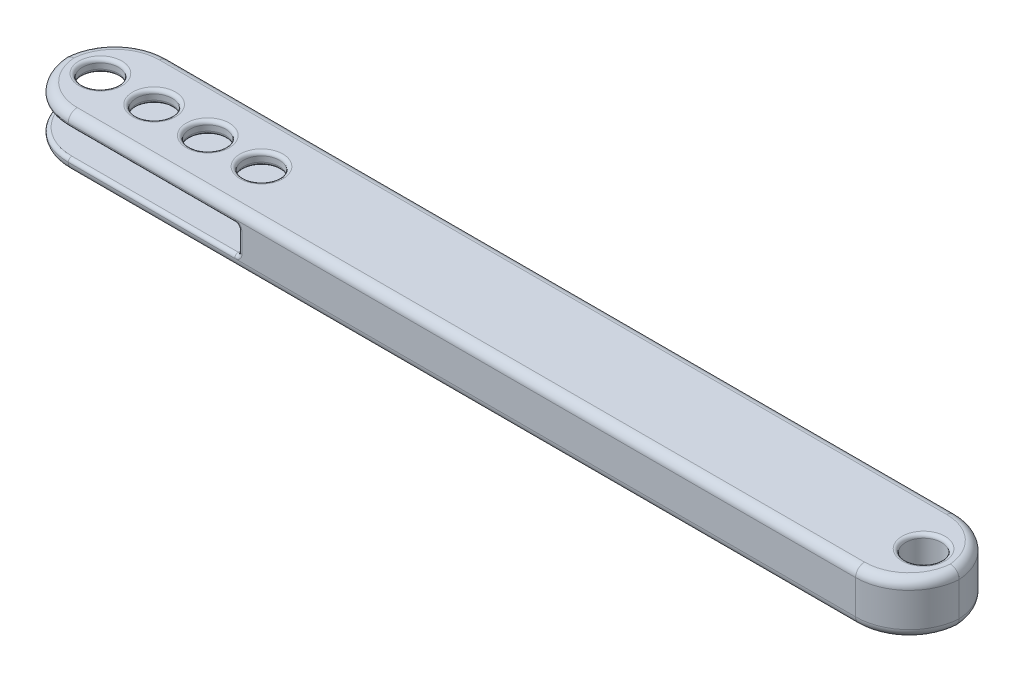
from build123d import *

# Parameters (mm, degrees)
SKETCH1_W           = 100
SKETCH1_H           = 11.2
BOSS_EXTRUDE1_DEPTH = 5.8
SKETCH2_R           = 2
CUT_EXTRUDE1_DEPTH  = 101.792261608
FILLET1_R           = 6
FILLET2_R           = 1
SKETCH3_W           = 25
SKETCH3_H           = 3
CUT_EXTRUDE2_DEPTH  = 101.779018478
FILLET3_R           = 0.4


with BuildPart() as part:
    # Sketch1 → Boss-Extrude1 (new body)
    with BuildSketch(Plane(origin=(0, 0, 0), x_dir=(1, 0, 0), z_dir=(0, 1, 0))):
        with Locations((50, 5.6)):
            Rectangle(SKETCH1_W, SKETCH1_H)
    extrude(amount=BOSS_EXTRUDE1_DEPTH)

    # Sketch2 → Cut-Extrude1 (cut, through all)
    with BuildSketch(Plane(origin=(0, 5.8, 0), x_dir=(1, 0, 0), z_dir=(0, 1, 0))):
        with Locations(Location((4, 5.6, 0), (0, 0, 270))):
            Circle(SKETCH2_R)
        with Locations(Location((96, 5.6, 0), (0, 0, 270))):
            Circle(SKETCH2_R)
        with Locations(Location((10, 5.6, 0), (0, 0, 270))):
            Circle(SKETCH2_R)
        with Locations(Location((16, 5.6, 0), (0, 0, 270))):
            Circle(SKETCH2_R)
        with Locations(Location((22, 5.6, 0), (0, 0, 270))):
            Circle(SKETCH2_R)
    extrude(amount=-CUT_EXTRUDE1_DEPTH, mode=Mode.SUBTRACT)

    # Fillet1
    # the kernel refuses this fillet: 6 mm, written as the material it takes off along each edge
    with BuildSketch(Plane(origin=(100, -15, 0), x_dir=(-1, 0, 0), z_dir=(0, 1, 0)), Plane(origin=(100, -15, -11.2), x_dir=(0, 0, 1), z_dir=(0, 1, 0))) as fillet1_piece_1:
        with BuildLine():
            CenterArc((FILLET1_R, -FILLET1_R), FILLET1_R, 90, 90)
            Line((0, -FILLET1_R), (0, 0))
            Line((0, 0), (FILLET1_R, 0))
        make_face()
    extrude(amount=35.8, mode=Mode.SUBTRACT)
    with BuildSketch(Plane(origin=(0, -15, -11.2), x_dir=(0, 0, 1), z_dir=(0, 1, 0)), Plane(origin=(0, -15, 0), x_dir=(1, 0, 0), z_dir=(0, 1, 0))) as fillet1_piece_2:
        with BuildLine():
            CenterArc((FILLET1_R, FILLET1_R), FILLET1_R, 180, 90)
            Line((0, FILLET1_R), (0, 0))
            Line((0, 0), (FILLET1_R, 0))
        make_face()
    extrude(amount=35.8, mode=Mode.SUBTRACT)

    # Fillet2
    # the kernel refuses this fillet: 1 mm, written as the material it takes off along each edge
    with BuildSketch(Plane(origin=(94, 0, -11.2), x_dir=(0, 0, 1), z_dir=(-1, 0, 0)), Plane(origin=(6, 5.8, 0), x_dir=(0, -1, 0), z_dir=(1, 0, 0))) as fillet2_piece_1:
        with BuildLine():
            CenterArc((FILLET2_R, FILLET2_R), FILLET2_R, 180, 90)
            Line((0, FILLET2_R), (0, 0))
            Line((0, 0), (FILLET2_R, 0))
        make_face()
    extrude(amount=88, mode=Mode.SUBTRACT)
    with BuildSketch(Plane(origin=(6, 0, 0), x_dir=(0, 1, 0), z_dir=(1, 0, 0)), Plane(origin=(94, 5.8, -11.2), x_dir=(0, 0, 1), z_dir=(-1, 0, 0))) as fillet2_piece_2:
        with BuildLine():
            CenterArc((FILLET2_R, -FILLET2_R), FILLET2_R, 90, 90)
            Line((0, -FILLET2_R), (0, 0))
            Line((0, 0), (FILLET2_R, 0))
        make_face()
    extrude(amount=88, mode=Mode.SUBTRACT)
    with BuildSketch(Plane(origin=(94, 0, -5.2), x_dir=(0, 0, -1), z_dir=(-1, 0, 0))) as fillet2_piece_3:
        with BuildLine():
            CenterArc((6 - FILLET2_R, -FILLET2_R), FILLET2_R, 0, 90)
            Line((6, -FILLET2_R), (6, 0))
            Line((6, 0), (6 - FILLET2_R, 0))
        make_face()
    revolve(axis=Axis((94, 0, -5.2), (0, -1, 0)), revolution_arc=110.05948027, mode=Mode.SUBTRACT)
    with BuildSketch(Plane(origin=(94, 0, -6), x_dir=(0.9393370543039388, 0, -0.3429954787043108), z_dir=(-0.3429954787043108, 0, -0.9393370543039388))) as fillet2_piece_4:
        with BuildLine():
            CenterArc((6 - FILLET2_R, -FILLET2_R), FILLET2_R, 0, 90)
            Line((6, -FILLET2_R), (6, 0))
            Line((6, 0), (6 - FILLET2_R, 0))
        make_face()
    revolve(axis=Axis((94, 0, -6), (0, -1, 0)), revolution_arc=110.05948027, mode=Mode.SUBTRACT)
    with BuildSketch(Plane(origin=(6, 0, -6), x_dir=(0, 0, 1), z_dir=(1, 0, 0))) as fillet2_piece_5:
        with BuildLine():
            CenterArc((6 - FILLET2_R, -FILLET2_R), FILLET2_R, 0, 90)
            Line((6, -FILLET2_R), (6, 0))
            Line((6, 0), (6 - FILLET2_R, 0))
        make_face()
    revolve(axis=Axis((6, 0, -6), (0, -1, 0)), revolution_arc=110.05948027, mode=Mode.SUBTRACT)
    with BuildSketch(Plane(origin=(6, 0, -5.2), x_dir=(-0.9393370543039198, 0, 0.3429954787043625), z_dir=(0.3429954787043625, 0, 0.9393370543039198))) as fillet2_piece_6:
        with BuildLine():
            CenterArc((6 - FILLET2_R, -FILLET2_R), FILLET2_R, 0, 90)
            Line((6, -FILLET2_R), (6, 0))
            Line((6, 0), (6 - FILLET2_R, 0))
        make_face()
    revolve(axis=Axis((6, 0, -5.2), (0, -1, 0)), revolution_arc=110.05948027, mode=Mode.SUBTRACT)
    with BuildSketch(Plane(origin=(94, 5.8, -5.2), x_dir=(0, 0, -1), z_dir=(-1, 0, 0))) as fillet2_piece_7:
        with BuildLine():
            CenterArc((6 - FILLET2_R, FILLET2_R), FILLET2_R, 270, 90)
            Line((6, FILLET2_R), (6, 0))
            Line((6, 0), (6 - FILLET2_R, 0))
        make_face()
    revolve(axis=Axis((94, 5.8, -5.2), (0, -1, 0)), revolution_arc=110.05948027, mode=Mode.SUBTRACT)
    with BuildSketch(Plane(origin=(94, 5.8, -6), x_dir=(0.9393370543039388, 0, -0.3429954787043108), z_dir=(-0.3429954787043108, 0, -0.9393370543039388))) as fillet2_piece_8:
        with BuildLine():
            CenterArc((6 - FILLET2_R, FILLET2_R), FILLET2_R, 270, 90)
            Line((6 - FILLET2_R, 0), (6, 0))
            Line((6, 0), (6, FILLET2_R))
        make_face()
    revolve(axis=Axis((94, 5.8, -6), (0, -1, 0)), revolution_arc=110.05948027, mode=Mode.SUBTRACT)
    with BuildSketch(Plane(origin=(6, 5.8, -6), x_dir=(0, 0, 1), z_dir=(1, 0, 0))) as fillet2_piece_9:
        with BuildLine():
            CenterArc((6 - FILLET2_R, FILLET2_R), FILLET2_R, 270, 90)
            Line((6, FILLET2_R), (6, 0))
            Line((6, 0), (6 - FILLET2_R, 0))
        make_face()
    revolve(axis=Axis((6, 5.8, -6), (0, -1, 0)), revolution_arc=110.05948027, mode=Mode.SUBTRACT)
    with BuildSketch(Plane(origin=(6, 5.8, -5.2), x_dir=(-0.9393370543039198, 0, 0.3429954787043625), z_dir=(0.3429954787043625, 0, 0.9393370543039198))) as fillet2_piece_10:
        with BuildLine():
            CenterArc((6 - FILLET2_R, FILLET2_R), FILLET2_R, 270, 90)
            Line((6, FILLET2_R), (6, 0))
            Line((6, 0), (6 - FILLET2_R, 0))
        make_face()
    revolve(axis=Axis((6, 5.8, -5.2), (0, -1, 0)), revolution_arc=110.05948027, mode=Mode.SUBTRACT)

    # Sketch3 → Cut-Extrude2 (cut, through all)
    with BuildSketch(Plane(origin=(0, 0, -11.2), x_dir=(-1, 0, 0), z_dir=(0, 0, -1))):
        with Locations((-12.513348181, 2.9)):
            Rectangle(SKETCH3_W, SKETCH3_H)
    extrude(amount=-CUT_EXTRUDE2_DEPTH, mode=Mode.SUBTRACT)

    # Fillet3
    # the kernel refuses this fillet: 0.4 mm, written as the material it adds along each edge
    with BuildSketch(Plane(origin=(25.013348181, 4.4, -11.2), x_dir=(-1, 0, 0), z_dir=(0, 0, 1)), Plane(origin=(25.013348181, 1.4, -11.2), x_dir=(0, 1, 0), z_dir=(0, 0, 1))) as fillet3_piece_1:
        with BuildLine():
            CenterArc((FILLET3_R, FILLET3_R), FILLET3_R, 180, 90)
            Line((0, FILLET3_R), (0, 0))
            Line((0, 0), (FILLET3_R, 0))
        make_face()
    extrude(amount=11.2)
    # the kernel refuses this fillet: 0.4 mm, written as the material it takes off along each edge
    with BuildSketch(Plane(origin=(96, 5.8, -5.6), x_dir=(0, 0, 1), z_dir=(-1, 0, 0))) as fillet3_2_piece_1:
        with BuildLine():
            CenterArc((2 + FILLET3_R, -FILLET3_R), FILLET3_R, 90, 90)
            Line((2, -FILLET3_R), (2, 0))
            Line((2, 0), (2 + FILLET3_R, 0))
        make_face()
    revolve(axis=Axis((96, 5.8, -5.6), (0, 1, 0)), mode=Mode.SUBTRACT)
    with BuildSketch(Plane(origin=(96, 0, -5.6), x_dir=(0, 0, 1), z_dir=(-1, 0, 0))) as fillet3_2_piece_2:
        with BuildLine():
            CenterArc((2 + FILLET3_R, FILLET3_R), FILLET3_R, 180, 90)
            Line((2, FILLET3_R), (2, 0))
            Line((2, 0), (2 + FILLET3_R, 0))
        make_face()
    revolve(axis=Axis((96, 0, -5.6), (0, 1, 0)), mode=Mode.SUBTRACT)
    with BuildSketch(Plane(origin=(4, 5.8, -5.6), x_dir=(0, 0, 1), z_dir=(-1, 0, 0))) as fillet3_2_piece_3:
        with BuildLine():
            CenterArc((2 + FILLET3_R, -FILLET3_R), FILLET3_R, 90, 90)
            Line((2, -FILLET3_R), (2, 0))
            Line((2, 0), (2 + FILLET3_R, 0))
        make_face()
    revolve(axis=Axis((4, 5.8, -5.6), (0, 1, 0)), mode=Mode.SUBTRACT)
    with BuildSketch(Plane(origin=(4, 4.4, -5.6), x_dir=(0, 0, 1), z_dir=(-1, 0, 0))) as fillet3_2_piece_4:
        with BuildLine():
            CenterArc((2 + FILLET3_R, FILLET3_R), FILLET3_R, 180, 90)
            Line((2, FILLET3_R), (2, 0))
            Line((2, 0), (2 + FILLET3_R, 0))
        make_face()
    revolve(axis=Axis((4, 4.4, -5.6), (0, 1, 0)), mode=Mode.SUBTRACT)
    with BuildSketch(Plane(origin=(4, 0, -5.6), x_dir=(0, 0, 1), z_dir=(-1, 0, 0))) as fillet3_2_piece_5:
        with BuildLine():
            CenterArc((2 + FILLET3_R, FILLET3_R), FILLET3_R, 180, 90)
            Line((2, FILLET3_R), (2, 0))
            Line((2, 0), (2 + FILLET3_R, 0))
        make_face()
    revolve(axis=Axis((4, 0, -5.6), (0, 1, 0)), mode=Mode.SUBTRACT)
    with BuildSketch(Plane(origin=(4, 1.4, -5.6), x_dir=(0, 0, 1), z_dir=(-1, 0, 0))) as fillet3_2_piece_6:
        with BuildLine():
            CenterArc((2 + FILLET3_R, -FILLET3_R), FILLET3_R, 90, 90)
            Line((2, -FILLET3_R), (2, 0))
            Line((2, 0), (2 + FILLET3_R, 0))
        make_face()
    revolve(axis=Axis((4, 1.4, -5.6), (0, 1, 0)), mode=Mode.SUBTRACT)
    with BuildSketch(Plane(origin=(22, 0, -5.6), x_dir=(0, 0, 1), z_dir=(-1, 0, 0))) as fillet3_2_piece_7:
        with BuildLine():
            CenterArc((2 + FILLET3_R, FILLET3_R), FILLET3_R, 180, 90)
            Line((2, FILLET3_R), (2, 0))
            Line((2, 0), (2 + FILLET3_R, 0))
        make_face()
    revolve(axis=Axis((22, 0, -5.6), (0, 1, 0)), mode=Mode.SUBTRACT)
    with BuildSketch(Plane(origin=(22, 1.4, -5.6), x_dir=(0, 0, 1), z_dir=(-1, 0, 0))) as fillet3_2_piece_8:
        with BuildLine():
            CenterArc((2 + FILLET3_R, -FILLET3_R), FILLET3_R, 90, 90)
            Line((2, -FILLET3_R), (2, 0))
            Line((2, 0), (2 + FILLET3_R, 0))
        make_face()
    revolve(axis=Axis((22, 1.4, -5.6), (0, 1, 0)), mode=Mode.SUBTRACT)
    with BuildSketch(Plane(origin=(22, 5.8, -5.6), x_dir=(0, 0, 1), z_dir=(-1, 0, 0))) as fillet3_2_piece_9:
        with BuildLine():
            CenterArc((2 + FILLET3_R, -FILLET3_R), FILLET3_R, 90, 90)
            Line((2, -FILLET3_R), (2, 0))
            Line((2, 0), (2 + FILLET3_R, 0))
        make_face()
    revolve(axis=Axis((22, 5.8, -5.6), (0, 1, 0)), mode=Mode.SUBTRACT)
    with BuildSketch(Plane(origin=(22, 4.4, -5.6), x_dir=(0, 0, 1), z_dir=(-1, 0, 0))) as fillet3_2_piece_10:
        with BuildLine():
            CenterArc((2 + FILLET3_R, FILLET3_R), FILLET3_R, 180, 90)
            Line((2, FILLET3_R), (2, 0))
            Line((2, 0), (2 + FILLET3_R, 0))
        make_face()
    revolve(axis=Axis((22, 4.4, -5.6), (0, 1, 0)), mode=Mode.SUBTRACT)
    with BuildSketch(Plane(origin=(16, 0, -5.6), x_dir=(0, 0, 1), z_dir=(-1, 0, 0))) as fillet3_2_piece_11:
        with BuildLine():
            CenterArc((2 + FILLET3_R, FILLET3_R), FILLET3_R, 180, 90)
            Line((2, FILLET3_R), (2, 0))
            Line((2, 0), (2 + FILLET3_R, 0))
        make_face()
    revolve(axis=Axis((16, 0, -5.6), (0, 1, 0)), mode=Mode.SUBTRACT)
    with BuildSketch(Plane(origin=(16, 1.4, -5.6), x_dir=(0, 0, 1), z_dir=(-1, 0, 0))) as fillet3_2_piece_12:
        with BuildLine():
            CenterArc((2 + FILLET3_R, -FILLET3_R), FILLET3_R, 90, 90)
            Line((2, -FILLET3_R), (2, 0))
            Line((2, 0), (2 + FILLET3_R, 0))
        make_face()
    revolve(axis=Axis((16, 1.4, -5.6), (0, 1, 0)), mode=Mode.SUBTRACT)
    with BuildSketch(Plane(origin=(16, 5.8, -5.6), x_dir=(0, 0, 1), z_dir=(-1, 0, 0))) as fillet3_2_piece_13:
        with BuildLine():
            CenterArc((2 + FILLET3_R, -FILLET3_R), FILLET3_R, 90, 90)
            Line((2, -FILLET3_R), (2, 0))
            Line((2, 0), (2 + FILLET3_R, 0))
        make_face()
    revolve(axis=Axis((16, 5.8, -5.6), (0, 1, 0)), mode=Mode.SUBTRACT)
    with BuildSketch(Plane(origin=(16, 4.4, -5.6), x_dir=(0, 0, 1), z_dir=(-1, 0, 0))) as fillet3_2_piece_14:
        with BuildLine():
            CenterArc((2 + FILLET3_R, FILLET3_R), FILLET3_R, 180, 90)
            Line((2, FILLET3_R), (2, 0))
            Line((2, 0), (2 + FILLET3_R, 0))
        make_face()
    revolve(axis=Axis((16, 4.4, -5.6), (0, 1, 0)), mode=Mode.SUBTRACT)
    with BuildSketch(Plane(origin=(10, 0, -5.6), x_dir=(0, 0, 1), z_dir=(-1, 0, 0))) as fillet3_2_piece_15:
        with BuildLine():
            CenterArc((2 + FILLET3_R, FILLET3_R), FILLET3_R, 180, 90)
            Line((2, FILLET3_R), (2, 0))
            Line((2, 0), (2 + FILLET3_R, 0))
        make_face()
    revolve(axis=Axis((10, 0, -5.6), (0, 1, 0)), mode=Mode.SUBTRACT)
    with BuildSketch(Plane(origin=(10, 1.4, -5.6), x_dir=(0, 0, 1), z_dir=(-1, 0, 0))) as fillet3_2_piece_16:
        with BuildLine():
            CenterArc((2 + FILLET3_R, -FILLET3_R), FILLET3_R, 90, 90)
            Line((2, -FILLET3_R), (2, 0))
            Line((2, 0), (2 + FILLET3_R, 0))
        make_face()
    revolve(axis=Axis((10, 1.4, -5.6), (0, 1, 0)), mode=Mode.SUBTRACT)
    with BuildSketch(Plane(origin=(10, 5.8, -5.6), x_dir=(0, 0, 1), z_dir=(-1, 0, 0))) as fillet3_2_piece_17:
        with BuildLine():
            CenterArc((2 + FILLET3_R, -FILLET3_R), FILLET3_R, 90, 90)
            Line((2, -FILLET3_R), (2, 0))
            Line((2, 0), (2 + FILLET3_R, 0))
        make_face()
    revolve(axis=Axis((10, 5.8, -5.6), (0, 1, 0)), mode=Mode.SUBTRACT)
    with BuildSketch(Plane(origin=(10, 4.4, -5.6), x_dir=(0, 0, 1), z_dir=(-1, 0, 0))) as fillet3_2_piece_18:
        with BuildLine():
            CenterArc((2 + FILLET3_R, FILLET3_R), FILLET3_R, 180, 90)
            Line((2, FILLET3_R), (2, 0))
            Line((2, 0), (2 + FILLET3_R, 0))
        make_face()
    revolve(axis=Axis((10, 4.4, -5.6), (0, 1, 0)), mode=Mode.SUBTRACT)
    # the kernel refuses this fillet: 0.4 mm, written as the material it takes off along each edge
    with BuildSketch(Plane(origin=(6, 4.4, -6), x_dir=(0, 0, 1), z_dir=(1, 0, 0))) as fillet3_3_piece_1:
        with BuildLine():
            CenterArc((6 - FILLET3_R, -FILLET3_R), FILLET3_R, 0, 90)
            Line((6, -FILLET3_R), (6, 0))
            Line((6, 0), (6 - FILLET3_R, 0))
        make_face()
    revolve(axis=Axis((6, 4.4, -6), (0, -1, 0)), revolution_arc=95.73025987, mode=Mode.SUBTRACT)
    with BuildSketch(Plane(origin=(6, 4.4, -5.2), x_dir=(-0.9950029770170926, 0, 0.09984525891159218), z_dir=(0.09984525891159218, 0, 0.9950029770170926))) as fillet3_3_piece_2:
        with BuildLine():
            CenterArc((6 - FILLET3_R, -FILLET3_R), FILLET3_R, 360, 90)
            Line((6, -FILLET3_R), (6, 0))
            Line((6, 0), (6 - FILLET3_R, 0))
        make_face()
    revolve(axis=Axis((6, 4.4, -5.2), (0, -1, 0)), revolution_arc=95.73025987, mode=Mode.SUBTRACT)
    with BuildSketch(Plane(origin=(6, 1.4, -6), x_dir=(0, 0, 1), z_dir=(1, 0, 0))) as fillet3_3_piece_3:
        with BuildLine():
            CenterArc((6 - FILLET3_R, FILLET3_R), FILLET3_R, 270, 90)
            Line((6 - FILLET3_R, 0), (6, 0))
            Line((6, 0), (6, FILLET3_R))
        make_face()
    revolve(axis=Axis((6, 1.4, -6), (0, -1, 0)), revolution_arc=95.73025987, mode=Mode.SUBTRACT)
    with BuildSketch(Plane(origin=(6, 1.4, -5.2), x_dir=(-0.9950029770170926, 0, 0.0998452589115928), z_dir=(0.0998452589115928, 0, 0.9950029770170926))) as fillet3_3_piece_4:
        with BuildLine():
            CenterArc((6 - FILLET3_R, FILLET3_R), FILLET3_R, 270, 90)
            Line((6, FILLET3_R), (6, 0))
            Line((6, 0), (6 - FILLET3_R, 0))
        make_face()
    revolve(axis=Axis((6, 1.4, -5.2), (0, -1, 0)), revolution_arc=95.73025987, mode=Mode.SUBTRACT)
    with BuildSketch(Plane(origin=(24.613348181, 4.4, 0), x_dir=(0, 1, 0), z_dir=(-1, 0, 0)), Plane(origin=(24.613348181, 4.4, -11.2), x_dir=(0, 0, 1), z_dir=(-1, 0, 0)), Plane(origin=(6, 1.4, 0), x_dir=(0, -1, 0), z_dir=(1, 0, 0)), Plane(origin=(6, 1.4, -11.2), x_dir=(0, 0, 1), z_dir=(1, 0, 0))) as fillet3_3_piece_5:
        with BuildLine():
            CenterArc((FILLET3_R, FILLET3_R), FILLET3_R, 180, 90)
            Line((0, FILLET3_R), (0, 0))
            Line((0, 0), (FILLET3_R, 0))
        make_face()
    extrude(amount=18.613348181, mode=Mode.SUBTRACT)
    with BuildSketch(Plane(origin=(25.013348181, 1.8, 0), x_dir=(1, 0, 0), z_dir=(0, 1, 0)), Plane(origin=(25.013348181, 1.8, -11.2), x_dir=(0, 0, 1), z_dir=(0, 1, 0))) as fillet3_3_piece_6:
        with BuildLine():
            CenterArc((FILLET3_R, FILLET3_R), FILLET3_R, 180, 90)
            Line((0, FILLET3_R), (0, 0))
            Line((0, 0), (FILLET3_R, 0))
        make_face()
    extrude(amount=2.2, mode=Mode.SUBTRACT)
    with BuildSketch(Plane(origin=(24.613348181, 1.8, -11.2), x_dir=(1, 0, 0), z_dir=(0, 1, 0))) as fillet3_3_piece_7:
        with BuildLine():
            CenterArc((0.4 + FILLET3_R, -FILLET3_R), FILLET3_R, 90, 90)
            Line((0.4 + FILLET3_R, 0), (0.4, 0))
            Line((0.4, 0), (0.4, -FILLET3_R))
        make_face()
    revolve(axis=Axis((24.613348181, 1.8, -11.2), (0, 0, -1)), revolution_arc=90, mode=Mode.SUBTRACT)
    with BuildSketch(Plane(origin=(24.613348181, 4, -11.2), x_dir=(0, 1, 0), z_dir=(-1, 0, 0))) as fillet3_3_piece_8:
        with BuildLine():
            CenterArc((0.4 + FILLET3_R, -FILLET3_R), FILLET3_R, 90, 90)
            Line((0.4 + FILLET3_R, 0), (0.4, 0))
            Line((0.4, 0), (0.4, -FILLET3_R))
        make_face()
    revolve(axis=Axis((24.613348181, 4, -11.2), (0, 0, -1)), revolution_arc=90, mode=Mode.SUBTRACT)
    with BuildSketch(Plane(origin=(24.613348181, 1.8, 0), x_dir=(1, 0, 0), z_dir=(0, 1, 0))) as fillet3_3_piece_9:
        with BuildLine():
            CenterArc((0.4 + FILLET3_R, FILLET3_R), FILLET3_R, 180, 90)
            Line((0.4, FILLET3_R), (0.4, 0))
            Line((0.4, 0), (0.4 + FILLET3_R, 0))
        make_face()
    revolve(axis=Axis((24.613348181, 1.8, 0), (0, 0, -1)), revolution_arc=90, mode=Mode.SUBTRACT)
    with BuildSketch(Plane(origin=(24.613348181, 4, 0), x_dir=(0, 1, 0), z_dir=(-1, 0, 0))) as fillet3_3_piece_10:
        with BuildLine():
            CenterArc((0.4 + FILLET3_R, FILLET3_R), FILLET3_R, 180, 90)
            Line((0.4, FILLET3_R), (0.4, 0))
            Line((0.4, 0), (0.4 + FILLET3_R, 0))
        make_face()
    revolve(axis=Axis((24.613348181, 4, 0), (0, 0, -1)), revolution_arc=90, mode=Mode.SUBTRACT)


solid = part.part
